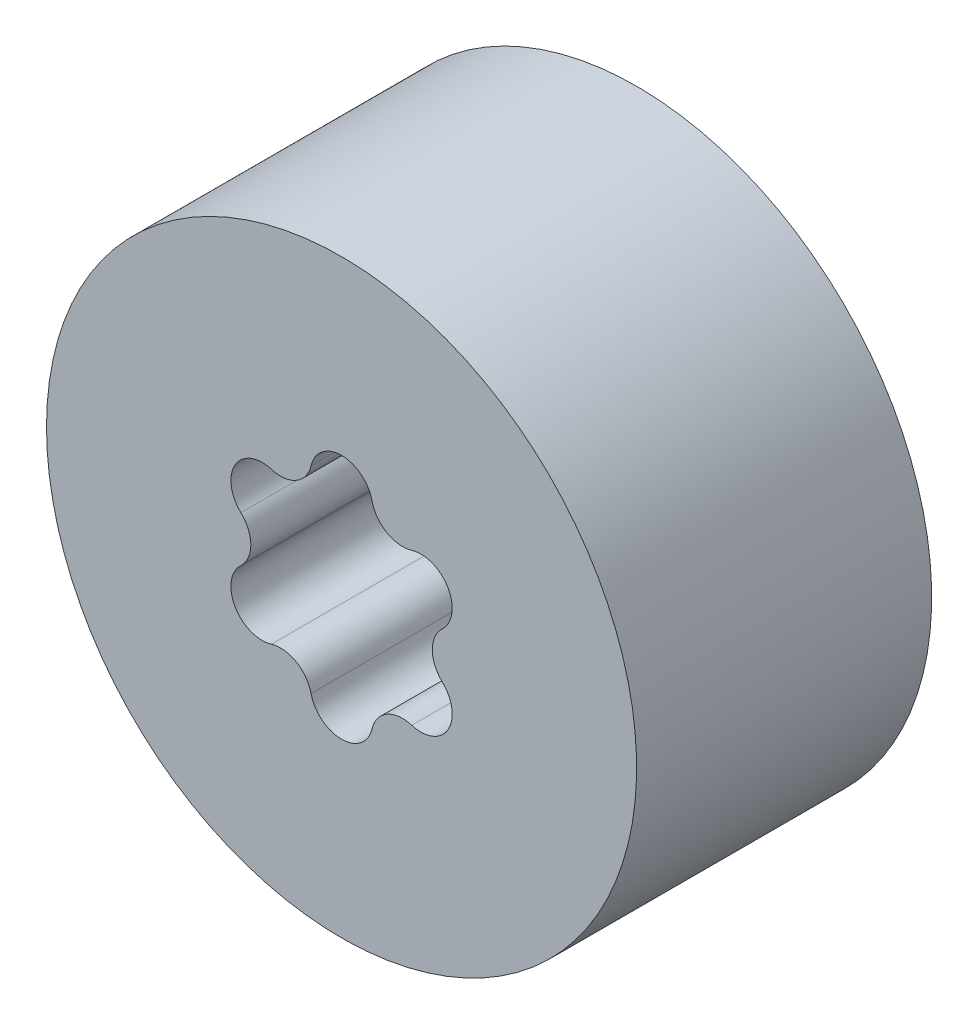
from build123d import *

# Parameters (mm, degrees)
SKETCH1_R           = 19.05
SKETCH1_R_2         = 5
BOSS_EXTRUDE1_DEPTH = 9.525
CUT_EXTRUDE1_DEPTH  = 33.995567884


with BuildPart() as part:
    # Sketch1 → Boss-Extrude1 (new, symmetric)
    with BuildSketch(Plane.XY):
        Circle(SKETCH1_R)
        Circle(SKETCH1_R_2, mode=Mode.SUBTRACT)
    extrude(amount=BOSS_EXTRUDE1_DEPTH, both=True)

    # Sketch2 → Cut-Extrude1 (cut, through all)
    with BuildSketch(Plane(origin=(0, 0, -9.525), x_dir=(-1, 0, 0), z_dir=(0, 0, -1))):
        with BuildLine():
            ThreePointArc((-1.969826172, -6.369877636), (-2.928940968, -5.07307457), (-4.531562766, -4.890858324))
            ThreePointArc((-4.531562766, -4.890858324), (-6.874076643, -3.96875), (-6.501388938, -1.479019312))
            ThreePointArc((-6.501388938, -1.479019312), (-5.857881937, 0), (-6.501388938, 1.479019312))
            ThreePointArc((-6.501388938, 1.479019312), (-6.874076643, 3.96875), (-4.531562766, 4.890858324))
            ThreePointArc((-4.531562766, 4.890858324), (-2.928940968, 5.07307457), (-1.969826172, 6.369877636))
            ThreePointArc((-1.969826172, 6.369877636), (0, 7.9375), (1.969826172, 6.369877636))
            ThreePointArc((1.969826172, 6.369877636), (2.928940968, 5.07307457), (4.531562766, 4.890858324))
            ThreePointArc((4.531562766, 4.890858324), (6.874076643, 3.96875), (6.501388938, 1.479019312))
            ThreePointArc((6.501388938, 1.479019312), (5.857881937, 0), (6.501388938, -1.479019312))
            ThreePointArc((6.501388938, -1.479019312), (6.874076643, -3.96875), (4.531562766, -4.890858324))
            ThreePointArc((4.531562766, -4.890858324), (2.928940968, -5.07307457), (1.969826172, -6.369877636))
            ThreePointArc((1.969826172, -6.369877636), (0, -7.9375), (-1.969826172, -6.369877636))
        make_face()
    extrude(amount=-CUT_EXTRUDE1_DEPTH, mode=Mode.SUBTRACT)


solid = part.part
